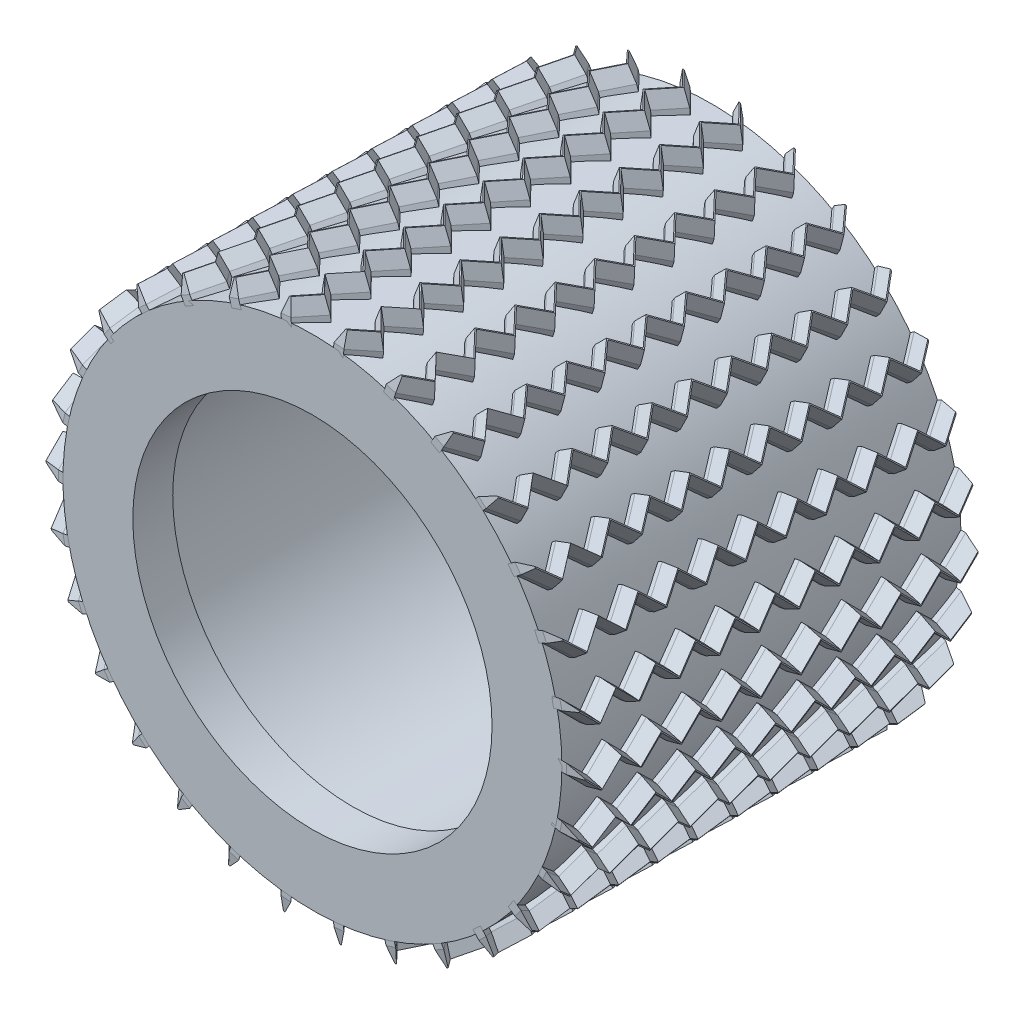
from build123d import *

# Parameters (mm, degrees)
CROQUIS1_R              = 125
CROQUIS1_R_2            = 100
SALIENTE_EXTRUIR1_DEPTH = 80
SALIENTE_EXTRUIR2_START = 20
CROQUIS5_R              = 125
CROQUIS5_R_2            = 90
SALIENTE_EXTRUIR2_DEPTH = 20
SALIENTE_EXTRUIR3_START = -2
SALIENTE_EXTRUIR3_DEPTH = 12
CHAFL_N1_SIZE           = 7.716831024
CHAFL_N1_SIZE_2         = 1.5
MATRIZC7_COUNT          = 30


with BuildPart() as part:
    # Croquis1 → Saliente-Extruir1 (new, symmetric)
    with BuildSketch(Plane.XY):
        Circle(CROQUIS1_R)
        Circle(CROQUIS1_R_2, mode=Mode.SUBTRACT)
    extrude(amount=SALIENTE_EXTRUIR1_DEPTH, both=True)

    # Croquis5 → Saliente-Extruir2 (add)
    with BuildSketch(Plane.XY.offset(80).offset(SALIENTE_EXTRUIR2_START)):
        Circle(CROQUIS5_R)
        Circle(CROQUIS5_R_2, mode=Mode.SUBTRACT)
    saliente_extruir2 = extrude(amount=-SALIENTE_EXTRUIR2_DEPTH)

    # Simetría1: Saliente-Extruir2 across plane
    add(saliente_extruir2.mirror(Plane.XY))


with BuildPart() as body_2:
    # Croquis6 → Saliente-Extruir3 (new body)
    with BuildSketch(Plane(origin=(125, 0, 0), x_dir=(0, 0, -1), z_dir=(1, 0, 0)).offset(SALIENTE_EXTRUIR3_START)):
        Polygon((-100, -2.5), (-100, 2.5), (-89.720842416, -7.866937135), (-80.013744405, 1.758658456), (-70.426515577, -7.90974793), (-60.013744405, 2.415595872), (-50.05585798, -7.626606565), (-40.013744405, 2.331191744), (-30.05585798, -7.711010694), (-20.013744405, 2.246787615), (-10.217845976, -7.632055231), (0, 2.5), (9.915327401, -7.5), (20, 2.5), (29.957886425, -7.542202437), (40, 2.415595872), (49.957886425, -7.626606565), (60, 2.331191744), (69.957886425, -7.711010694), (80, 2.246787615), (89.789084168, -7.625183273), (100, 2.5), (100, -2.5), (89.789084168, -12.625183273), (80, -2.753212385), (69.957886425, -12.711010694), (60, -2.668808256), (49.957886425, -12.626606565), (40, -2.584404128), (29.957886425, -12.542202437), (20, -2.5), (9.915327401, -12.5), (0, -2.5), (-10.217845976, -12.632055231), (-20.013744405, -2.753212385), (-30.05585798, -12.711010694), (-40.013744405, -2.668808256), (-50.05585798, -12.626606565), (-60.013744405, -2.584404128), (-70.05585798, -12.542202437), (-80.013744405, -2.5), (-90.091486613, -12.493127798), align=None)
    extrude(amount=SALIENTE_EXTRUIR3_DEPTH)

    # Chaflán1
    # the kernel refuses this chamfer: 7.716831024, 1.5 mm, written as the material it takes off along each edge
    with BuildSketch(Plane(origin=(135, 16.568412983, -45.882316853), x_dir=(-1, 0, 0), z_dir=(0, -0.7100814791090776, -0.7041195161520982)), Plane(origin=(135, 16.652817111, -25.882316853), x_dir=(-1, 0, 0), z_dir=(0, -0.7100814791090777, -0.704119516152098)), Plane(origin=(135, 16.73722124, -5.882316853), x_dir=(-1, 0, 0), z_dir=(0, -0.7100814791090777, -0.7041195161520979)), Plane(origin=(135, -26.779423677, 55.938174833), x_dir=(-1, 0, 0), z_dir=(0, 0.7100814791090772, 0.7041195161520984)), Plane(origin=(135, 16.568412983, 54.131427552), x_dir=(-1, 0, 0), z_dir=(0, -0.7100814791090766, -0.704119516152099)), Plane(origin=(135, 16.652817111, 74.131427552), x_dir=(-1, 0, 0), z_dir=(0, -0.7100814791090765, -0.7041195161520992)), Plane(origin=(135, -26.863827805, 35.938174833), x_dir=(-1, 0, 0), z_dir=(0, 0.7100814791090778, 0.7041195161520979)), Plane(origin=(135, -26.948231933, 15.938174833), x_dir=(-1, 0, 0), z_dir=(0, 0.7100814791090774, 0.7041195161520982)), Plane(origin=(135, -26.779423677, -44.075569572), x_dir=(-1, 0, 0), z_dir=(0, 0.7100814791090766, 0.704119516152099)), Plane(origin=(135, -26.863827805, -64.075569572), x_dir=(-1, 0, 0), z_dir=(0, 0.7100814791090769, 0.7041195161520987)), Plane(origin=(135, -26.948231933, -84.075569572), x_dir=(-1, 0, 0), z_dir=(0, 0.7100814791090765, 0.7041195161520991))) as chafl_n1_piece_1:
        Polygon((CHAFL_N1_SIZE, 0), (0, -CHAFL_N1_SIZE_2), (0, 0), align=None)
    extrude(amount=34.192447474, mode=Mode.SUBTRACT)
    with BuildSketch(Plane(origin=(135, -7.626606565, -49.957886425), x_dir=(-1, 0, 0), z_dir=(0, 0.7041195161520981, -0.7100814791090776)), Plane(origin=(135, -7.542202437, -29.957886425), x_dir=(-1, 0, 0), z_dir=(0, 0.7041195161520979, -0.7100814791090777)), Plane(origin=(135, -7.711010694, 30.05585798), x_dir=(-1, 0, 0), z_dir=(0, 0.7041195161520991, -0.7100814791090765)), Plane(origin=(135, -7.626606565, 50.05585798), x_dir=(-1, 0, 0), z_dir=(0, 0.7041195161520992, -0.7100814791090764)), Plane(origin=(135, -2.584404128, 60.013744405), x_dir=(-1, 0, 0), z_dir=(0, -0.7041195161520983, 0.7100814791090773)), Plane(origin=(135, -2.668808256, 40.013744405), x_dir=(-1, 0, 0), z_dir=(0, -0.704119516152098, 0.7100814791090777)), Plane(origin=(135, -2.753212385, 20.013744405), x_dir=(-1, 0, 0), z_dir=(0, -0.7041195161520983, 0.7100814791090773)), Plane(origin=(135, -2.584404128, -40), x_dir=(-1, 0, 0), z_dir=(0, -0.7041195161520991, 0.7100814791090765)), Plane(origin=(135, -2.668808256, -60), x_dir=(-1, 0, 0), z_dir=(0, -0.7041195161520988, 0.7100814791090768)), Plane(origin=(135, -2.753212385, -80), x_dir=(-1, 0, 0), z_dir=(0, -0.7041195161520991, 0.7100814791090766)), Plane(origin=(135, -7.711010694, -69.957886425), x_dir=(-1, 0, 0), z_dir=(0, 0.7041195161520983, -0.7100814791090773))) as chafl_n1_piece_2:
        Polygon((CHAFL_N1_SIZE, 0), (0, -CHAFL_N1_SIZE_2), (0, 0), align=None)
    extrude(amount=34.192322331, mode=Mode.SUBTRACT)
    with BuildSketch(Plane(origin=(135, -21.617683147, 4.321893839), x_dir=(-1, 0, 0), z_dir=(0, 0.704119516152098, -0.7100814791090777))) as chafl_n1_piece_3_section:
        Polygon((CHAFL_N1_SIZE, 0), (0, -CHAFL_N1_SIZE_2), (0, 0), align=None)
    chafl_n1_piece_3 = extrude(amount=54.302381083, mode=Mode.PRIVATE)
    chafl_n1_piece_3 = split(chafl_n1_piece_3, bisect_by=Plane(origin=(135, -7.500510383, -9.915833463), z_dir=(0, 0.7040940612347721, -0.7101067193978136)), keep=Keep.TOP, mode=Mode.PRIVATE)
    add(chafl_n1_piece_3, mode=Mode.SUBTRACT)
    with BuildSketch(Plane(origin=(135, 16.737727311, 14.117172773), x_dir=(-1, 0, 0), z_dir=(0, -0.7101067193978136, -0.7040940612347721))) as chafl_n1_piece_4_section:
        Polygon((CHAFL_N1_SIZE, 0), (0, -CHAFL_N1_SIZE_2), (0, 0), align=None)
    chafl_n1_piece_4 = extrude(amount=54.182637018, mode=Mode.PRIVATE)
    chafl_n1_piece_4 = split(chafl_n1_piece_4, bisect_by=Plane(origin=(135, -7.49913847, -9.916196226), z_dir=(0, 0.7100814791090777, 0.704119516152098)), keep=Keep.TOP, mode=Mode.PRIVATE)
    add(chafl_n1_piece_4, mode=Mode.SUBTRACT)
    with BuildSketch(Plane(origin=(135, -7.632055231, 10.217845976), x_dir=(-1, 0, 0), z_dir=(0, 0.7041195161520996, -0.710081479109076))) as chafl_n1_piece_5:
        Polygon((CHAFL_N1_SIZE, 0), (0, -CHAFL_N1_SIZE_2), (0, 0), align=None)
    extrude(amount=34.439804354, mode=Mode.SUBTRACT)
    with BuildSketch(Plane(origin=(135, 16.484008855, 34.131427552), x_dir=(-1, 0, 0), z_dir=(0, -0.7100814791090765, -0.7041195161520992)), Plane(origin=(135, -26.869276471, -3.899837171), x_dir=(-1, 0, 0), z_dir=(0, 0.7100814791090776, 0.7041195161520982))) as chafl_n1_piece_6:
        Polygon((CHAFL_N1_SIZE, 0), (0, -CHAFL_N1_SIZE_2), (0, 0), align=None)
    extrude(amount=33.962389945, mode=Mode.SUBTRACT)
    with BuildSketch(Plane(origin=(135, -7.90974793, 70.426515577), x_dir=(-1, 0, 0), z_dir=(0, 0.704119516152099, -0.7100814791090767))) as chafl_n1_piece_7:
        Polygon((CHAFL_N1_SIZE, 0), (0, -CHAFL_N1_SIZE_2), (0, 0), align=None)
    extrude(amount=34.71431538, mode=Mode.SUBTRACT)
    with BuildSketch(Plane(origin=(135, 15.995879696, 94.131427552), x_dir=(-1, 0, 0), z_dir=(0, -0.7100814791090776, -0.704119516152098))) as chafl_n1_piece_8:
        Polygon((CHAFL_N1_SIZE, 0), (0, -CHAFL_N1_SIZE_2), (0, 0), align=None)
    extrude(amount=33.666034574, mode=Mode.SUBTRACT)
    with BuildSketch(Plane(origin=(135, -21.984620282, 103.958063656), x_dir=(-1, 0, 0), z_dir=(0, 0.7041195161520977, -0.710081479109078))) as chafl_n1_piece_9_section:
        Polygon((CHAFL_N1_SIZE, 0), (0, -CHAFL_N1_SIZE_2), (0, 0), align=None)
    chafl_n1_piece_9 = extrude(amount=53.77064691, mode=Mode.PRIVATE)
    chafl_n1_piece_9 = split(chafl_n1_piece_9, bisect_by=Plane(origin=(135, -7.867447519, 89.720336354), z_dir=(0, 0.7040940612347715, -0.7101067193978142)), keep=Keep.TOP, mode=Mode.PRIVATE)
    add(chafl_n1_piece_9, mode=Mode.SUBTRACT)
    with BuildSketch(Plane(origin=(135, 16.737727311, 114.117172773), x_dir=(-1, 0, 0), z_dir=(0, -0.7101067193978142, -0.7040940612347715))) as chafl_n1_piece_10_section:
        Polygon((CHAFL_N1_SIZE, 0), (0, -CHAFL_N1_SIZE_2), (0, 0), align=None)
    chafl_n1_piece_10 = extrude(amount=54.699372215, mode=Mode.PRIVATE)
    chafl_n1_piece_10 = split(chafl_n1_piece_10, bisect_by=Plane(origin=(135, -7.866062562, 89.719960438), z_dir=(0, 0.710081479109078, 0.7041195161520977)), keep=Keep.TOP, mode=Mode.PRIVATE)
    add(chafl_n1_piece_10, mode=Mode.SUBTRACT)
    with BuildSketch(Plane(origin=(135, -22.550123343, 100), x_dir=(-1, 0, 0), z_dir=(0, 1, 0)), Plane(origin=(135, 22.550123343, -100), x_dir=(-1, 0, 0), z_dir=(0, -1, 0))) as chafl_n1_piece_11:
        Polygon((CHAFL_N1_SIZE, 0), (0, -CHAFL_N1_SIZE_2), (0, 0), align=None)
    extrude(amount=45.100246686, mode=Mode.SUBTRACT)
    with BuildSketch(Plane(origin=(135, 11.617683147, -14.23722124), x_dir=(-1, 0, 0), z_dir=(0, -0.7041195161520982, 0.7100814791090774))) as chafl_n1_piece_12_section:
        Polygon((CHAFL_N1_SIZE, 0), (0, -CHAFL_N1_SIZE_2), (0, 0), align=None)
    chafl_n1_piece_12 = extrude(amount=54.489927697, mode=Mode.PRIVATE)
    chafl_n1_piece_12 = split(chafl_n1_piece_12, bisect_by=Plane(origin=(135, -2.499489617, 0.000506062), z_dir=(0, -0.7040940612347731, 0.7101067193978126)), keep=Keep.TOP, mode=Mode.PRIVATE)
    add(chafl_n1_piece_12, mode=Mode.SUBTRACT)
    with BuildSketch(Plane(origin=(135, -26.737727311, -24.032500174), x_dir=(-1, 0, 0), z_dir=(0, 0.7101067193978126, 0.7040940612347731))) as chafl_n1_piece_13_section:
        Polygon((CHAFL_N1_SIZE, 0), (0, -CHAFL_N1_SIZE_2), (0, 0), align=None)
    chafl_n1_piece_13 = extrude(amount=54.182637018, mode=Mode.PRIVATE)
    chafl_n1_piece_13 = split(chafl_n1_piece_13, bisect_by=Plane(origin=(135, -2.50086153, 0.000868825), z_dir=(0, -0.7100814791090774, -0.7041195161520982)), keep=Keep.TOP, mode=Mode.PRIVATE)
    add(chafl_n1_piece_13, mode=Mode.SUBTRACT)
    with BuildSketch(Plane(origin=(135, -2.5, -20), x_dir=(-1, 0, 0), z_dir=(0, -0.7041195161520988, 0.7100814791090769))) as chafl_n1_piece_14:
        Polygon((CHAFL_N1_SIZE, 0), (0, -CHAFL_N1_SIZE_2), (0, 0), align=None)
    extrude(amount=34.25225774, mode=Mode.SUBTRACT)
    with BuildSketch(Plane(origin=(135, -26.730855108, 75.97431384), x_dir=(-1, 0, 0), z_dir=(0, 0.7101067193978129, 0.7040940612347727))) as chafl_n1_piece_15:
        Polygon((CHAFL_N1_SIZE, 0), (0, -CHAFL_N1_SIZE_2), (0, 0), align=None)
    extrude(amount=54.172959314, mode=Mode.SUBTRACT)
    with BuildSketch(Plane(origin=(135, -26.862404513, -103.906767315), x_dir=(-1, 0, 0), z_dir=(0, 0.7100814791090764, 0.7041195161520992)), Plane(origin=(135, 16.484008855, -65.882316853), x_dir=(-1, 0, 0), z_dir=(0, -0.710081479109077, -0.7041195161520986))) as chafl_n1_piece_16:
        Polygon((CHAFL_N1_SIZE, 0), (0, -CHAFL_N1_SIZE_2), (0, 0), align=None)
    extrude(amount=33.952712241, mode=Mode.SUBTRACT)
    with BuildSketch(Plane(origin=(135, 11.617683147, -114.23722124), x_dir=(-1, 0, 0), z_dir=(0, -0.7041195161520994, 0.7100814791090763))) as chafl_n1_piece_17:
        Polygon((CHAFL_N1_SIZE, 0), (0, -CHAFL_N1_SIZE_2), (0, 0), align=None)
    extrude(amount=54.48016805, mode=Mode.SUBTRACT)
    with BuildSketch(Plane(origin=(135, -7.625183273, -89.789084168), x_dir=(-1, 0, 0), z_dir=(0, 0.7041195161520982, -0.7100814791090774))) as chafl_n1_piece_18:
        Polygon((CHAFL_N1_SIZE, 0), (0, -CHAFL_N1_SIZE_2), (0, 0), align=None)
    extrude(amount=34.430044707, mode=Mode.SUBTRACT)
    with BuildSketch(Plane(origin=(135, -2.5, 80.013744405), x_dir=(-1, 0, 0), z_dir=(0, -0.7041195161520988, 0.7100814791090768))) as chafl_n1_piece_19:
        Polygon((CHAFL_N1_SIZE, 0), (0, -CHAFL_N1_SIZE_2), (0, 0), align=None)
    extrude(amount=34.242497746, mode=Mode.SUBTRACT)
    with BuildSketch(Plane(origin=(135, 2.331191744, -60), x_dir=(-1, 0, 0), z_dir=(0, -0.7100814791090776, -0.7041195161520982))) as chafl_n1_piece_20a_section:
        Polygon((CHAFL_N1_SIZE, 0), (0, -CHAFL_N1_SIZE_2), (0, 0), align=None)
    chafl_n1_piece_20a = extrude(amount=34.192447474, mode=Mode.PRIVATE)
    chafl_n1_piece_20a = split(chafl_n1_piece_20a, bisect_by=Plane(origin=(135, -7.711010694, -69.957886425), z_dir=(0, -0.7100814791090773, -0.7041195161520983)), keep=Keep.TOP, mode=Mode.PRIVATE)
    chafl_n1_piece_20a = split(chafl_n1_piece_20a, bisect_by=Plane(origin=(135, -10.232089228, -72.457797562), z_dir=(0, 0.7100814791090766, 0.7041195161520991)), keep=Keep.TOP, mode=Mode.PRIVATE)
    with BuildSketch(Plane(origin=(135, -21.828693841, -55.720665185), x_dir=(-1, 0, 0), z_dir=(0, 0.7041195161520983, -0.7100814791090773))) as chafl_n1_piece_20b_section:
        Polygon((CHAFL_N1_SIZE, 0), (0, -CHAFL_N1_SIZE_2), (0, 0), align=None)
    chafl_n1_piece_20b = extrude(amount=34.192322331, mode=Mode.PRIVATE)
    chafl_n1_piece_20b = split(chafl_n1_piece_20b, bisect_by=Plane(origin=(135, -7.711010694, -69.957886425), z_dir=(0, -0.7041195161520981, 0.7100814791090775)), keep=Keep.TOP, mode=Mode.PRIVATE)
    chafl_n1_piece_20b = split(chafl_n1_piece_20b, bisect_by=Plane(origin=(135, -10.189932159, -67.457975287), z_dir=(0, 0.7041195161520991, -0.7100814791090765)), keep=Keep.TOP, mode=Mode.PRIVATE)
    chafl_n1_piece_20 = chafl_n1_piece_20a & chafl_n1_piece_20b
    add(chafl_n1_piece_20, mode=Mode.SUBTRACT)
    with BuildSketch(Plane(origin=(135, 2.415595872, -40), x_dir=(-1, 0, 0), z_dir=(0, -0.7100814791090777, -0.704119516152098))) as chafl_n1_piece_21a_section:
        Polygon((CHAFL_N1_SIZE, 0), (0, -CHAFL_N1_SIZE_2), (0, 0), align=None)
    chafl_n1_piece_21a = extrude(amount=34.192447474, mode=Mode.PRIVATE)
    chafl_n1_piece_21a = split(chafl_n1_piece_21a, bisect_by=Plane(origin=(135, -7.626606565, -49.957886425), z_dir=(0, -0.7100814791090776, -0.7041195161520981)), keep=Keep.TOP, mode=Mode.PRIVATE)
    chafl_n1_piece_21a = split(chafl_n1_piece_21a, bisect_by=Plane(origin=(135, -10.1476851, -52.457797562), z_dir=(0, 0.7100814791090768, 0.7041195161520988)), keep=Keep.TOP, mode=Mode.PRIVATE)
    with BuildSketch(Plane(origin=(135, -21.744289712, -35.720665185), x_dir=(-1, 0, 0), z_dir=(0, 0.7041195161520981, -0.7100814791090776))) as chafl_n1_piece_21b_section:
        Polygon((CHAFL_N1_SIZE, 0), (0, -CHAFL_N1_SIZE_2), (0, 0), align=None)
    chafl_n1_piece_21b = extrude(amount=34.192322331, mode=Mode.PRIVATE)
    chafl_n1_piece_21b = split(chafl_n1_piece_21b, bisect_by=Plane(origin=(135, -7.626606565, -49.957886425), z_dir=(0, -0.704119516152098, 0.7100814791090777)), keep=Keep.TOP, mode=Mode.PRIVATE)
    chafl_n1_piece_21b = split(chafl_n1_piece_21b, bisect_by=Plane(origin=(135, -10.105528031, -47.457975287), z_dir=(0, 0.7041195161520987, -0.7100814791090769)), keep=Keep.TOP, mode=Mode.PRIVATE)
    chafl_n1_piece_21 = chafl_n1_piece_21a & chafl_n1_piece_21b
    add(chafl_n1_piece_21, mode=Mode.SUBTRACT)
    with BuildSketch(Plane(origin=(135, 2.5, -20), x_dir=(-1, 0, 0), z_dir=(0, -0.7100814791090777, -0.7041195161520979))) as chafl_n1_piece_22a_section:
        Polygon((CHAFL_N1_SIZE, 0), (0, -CHAFL_N1_SIZE_2), (0, 0), align=None)
    chafl_n1_piece_22a = extrude(amount=34.192447474, mode=Mode.PRIVATE)
    chafl_n1_piece_22a = split(chafl_n1_piece_22a, bisect_by=Plane(origin=(135, -7.542202437, -29.957886425), z_dir=(0, -0.7100814791090777, -0.7041195161520979)), keep=Keep.TOP, mode=Mode.PRIVATE)
    chafl_n1_piece_22a = split(chafl_n1_piece_22a, bisect_by=Plane(origin=(135, -10.063280972, -32.457797562), z_dir=(0, 0.7100814791090765, 0.7041195161520991)), keep=Keep.TOP, mode=Mode.PRIVATE)
    with BuildSketch(Plane(origin=(135, -21.659885584, -15.720665185), x_dir=(-1, 0, 0), z_dir=(0, 0.7041195161520979, -0.7100814791090777))) as chafl_n1_piece_22b_section:
        Polygon((CHAFL_N1_SIZE, 0), (0, -CHAFL_N1_SIZE_2), (0, 0), align=None)
    chafl_n1_piece_22b = extrude(amount=34.192322331, mode=Mode.PRIVATE)
    chafl_n1_piece_22b = split(chafl_n1_piece_22b, bisect_by=Plane(origin=(135, -7.542202437, -29.957886425), z_dir=(0, -0.7041195161520979, 0.7100814791090777)), keep=Keep.TOP, mode=Mode.PRIVATE)
    chafl_n1_piece_22b = split(chafl_n1_piece_22b, bisect_by=Plane(origin=(135, -10.021123902, -27.457975287), z_dir=(0, 0.704119516152099, -0.7100814791090766)), keep=Keep.TOP, mode=Mode.PRIVATE)
    chafl_n1_piece_22 = chafl_n1_piece_22a & chafl_n1_piece_22b
    add(chafl_n1_piece_22, mode=Mode.SUBTRACT)
    with BuildSketch(Plane(origin=(135, 16.737727311, 14.117172773), x_dir=(-1, 0, 0), z_dir=(0, -0.7101067193978136, -0.7040940612347721))) as chafl_n1_piece_23a_section:
        Polygon((CHAFL_N1_SIZE, 0), (0, -CHAFL_N1_SIZE_2), (0, 0), align=None)
    chafl_n1_piece_23a = extrude(amount=54.182637018, mode=Mode.PRIVATE)
    chafl_n1_piece_23a = split(chafl_n1_piece_23a, bisect_by=Plane(origin=(135, -7.49913847, -9.916196226), z_dir=(0, -0.7100814791090777, -0.704119516152098)), keep=Keep.TOP, mode=Mode.PRIVATE)
    chafl_n1_piece_23a = split(chafl_n1_piece_23a, bisect_by=Plane(origin=(135, -10.020217005, -12.416107363), z_dir=(0, 0.7100814791090769, 0.7041195161520988)), keep=Keep.TOP, mode=Mode.PRIVATE)
    with BuildSketch(Plane(origin=(135, -21.617683147, 4.321893839), x_dir=(-1, 0, 0), z_dir=(0, 0.704119516152098, -0.7100814791090777))) as chafl_n1_piece_23b_section:
        Polygon((CHAFL_N1_SIZE, 0), (0, -CHAFL_N1_SIZE_2), (0, 0), align=None)
    chafl_n1_piece_23b = extrude(amount=34.25225774, mode=Mode.PRIVATE)
    chafl_n1_piece_23b = split(chafl_n1_piece_23b, bisect_by=Plane(origin=(135, -7.500510383, -9.915833463), z_dir=(0, -0.7040940612347721, 0.7101067193978136)), keep=Keep.TOP, mode=Mode.PRIVATE)
    chafl_n1_piece_23b = split(chafl_n1_piece_23b, bisect_by=Plane(origin=(135, -9.979252619, -7.415923843), z_dir=(0, 0.7040940612347731, -0.7101067193978126)), keep=Keep.TOP, mode=Mode.PRIVATE)
    chafl_n1_piece_23 = chafl_n1_piece_23a & chafl_n1_piece_23b
    add(chafl_n1_piece_23, mode=Mode.SUBTRACT)
    with BuildSketch(Plane(origin=(135, 2.246787615, 20.013744405), x_dir=(-1, 0, 0), z_dir=(0, -0.7100814791090765, -0.7041195161520992))) as chafl_n1_piece_24a_section:
        Polygon((CHAFL_N1_SIZE, 0), (0, -CHAFL_N1_SIZE_2), (0, 0), align=None)
    chafl_n1_piece_24a = extrude(amount=33.962389945, mode=Mode.PRIVATE)
    chafl_n1_piece_24a = split(chafl_n1_piece_24a, bisect_by=Plane(origin=(135, -7.632055231, 10.217845976), z_dir=(0, -0.710081479109076, -0.7041195161520996)), keep=Keep.TOP, mode=Mode.PRIVATE)
    chafl_n1_piece_24a = split(chafl_n1_piece_24a, bisect_by=Plane(origin=(135, -10.153133766, 7.717934839), z_dir=(0, 0.7100814791090774, 0.7041195161520982)), keep=Keep.TOP, mode=Mode.PRIVATE)
    with BuildSketch(Plane(origin=(135, -21.749738378, 24.455067216), x_dir=(-1, 0, 0), z_dir=(0, 0.7041195161520996, -0.710081479109076))) as chafl_n1_piece_24b_section:
        Polygon((CHAFL_N1_SIZE, 0), (0, -CHAFL_N1_SIZE_2), (0, 0), align=None)
    chafl_n1_piece_24b = extrude(amount=54.489927697, mode=Mode.PRIVATE)
    chafl_n1_piece_24b = split(chafl_n1_piece_24b, bisect_by=Plane(origin=(135, -7.632055231, 10.217845976), z_dir=(0, -0.7041195161520992, 0.7100814791090765)), keep=Keep.TOP, mode=Mode.PRIVATE)
    chafl_n1_piece_24b = split(chafl_n1_piece_24b, bisect_by=Plane(origin=(135, -10.110976696, 12.717757114), z_dir=(0, 0.7041195161520981, -0.7100814791090775)), keep=Keep.TOP, mode=Mode.PRIVATE)
    chafl_n1_piece_24 = chafl_n1_piece_24a & chafl_n1_piece_24b
    add(chafl_n1_piece_24, mode=Mode.SUBTRACT)
    with BuildSketch(Plane(origin=(135, -12.542202437, 70.05585798), x_dir=(-1, 0, 0), z_dir=(0, 0.7100814791090772, 0.7041195161520984))) as chafl_n1_piece_25a_section:
        Polygon((CHAFL_N1_SIZE, 0), (0, -CHAFL_N1_SIZE_2), (0, 0), align=None)
    chafl_n1_piece_25a = extrude(amount=34.192447474, mode=Mode.PRIVATE)
    chafl_n1_piece_25a = split(chafl_n1_piece_25a, bisect_by=Plane(origin=(135, -0.352717516, 82.142997946), z_dir=(0, -0.710081479109078, -0.7041195161520977)), keep=Keep.TOP, mode=Mode.PRIVATE)
    chafl_n1_piece_25a = split(chafl_n1_piece_25a, bisect_by=Plane(origin=(135, -2.5, 80.013744405), z_dir=(0, 0.7100814791090768, 0.7041195161520988)), keep=Keep.TOP, mode=Mode.PRIVATE)
    with BuildSketch(Plane(origin=(135, 11.617683147, 65.776523165), x_dir=(-1, 0, 0), z_dir=(0, -0.7041195161520988, 0.7100814791090768))) as chafl_n1_piece_25b_section:
        Polygon((CHAFL_N1_SIZE, 0), (0, -CHAFL_N1_SIZE_2), (0, 0), align=None)
    chafl_n1_piece_25b = extrude(amount=54.292621089, mode=Mode.PRIVATE)
    chafl_n1_piece_25b = split(chafl_n1_piece_25b, bisect_by=Plane(origin=(135, -0.388624028, 77.884490864), z_dir=(0, -0.704119516152098, 0.7100814791090776)), keep=Keep.TOP, mode=Mode.PRIVATE)
    chafl_n1_piece_25b = split(chafl_n1_piece_25b, bisect_by=Plane(origin=(135, -2.5, 80.013744405), z_dir=(0, 0.7041195161520984, -0.7100814791090772)), keep=Keep.TOP, mode=Mode.PRIVATE)
    chafl_n1_piece_25 = chafl_n1_piece_25a & chafl_n1_piece_25b
    add(chafl_n1_piece_25, mode=Mode.SUBTRACT)
    with BuildSketch(Plane(origin=(135, 2.331191744, 40.013744405), x_dir=(-1, 0, 0), z_dir=(0, -0.7100814791090766, -0.704119516152099))) as chafl_n1_piece_26a_section:
        Polygon((CHAFL_N1_SIZE, 0), (0, -CHAFL_N1_SIZE_2), (0, 0), align=None)
    chafl_n1_piece_26a = extrude(amount=34.192447474, mode=Mode.PRIVATE)
    chafl_n1_piece_26a = split(chafl_n1_piece_26a, bisect_by=Plane(origin=(135, -7.711010694, 30.05585798), z_dir=(0, -0.7100814791090765, -0.7041195161520991)), keep=Keep.TOP, mode=Mode.PRIVATE)
    chafl_n1_piece_26a = split(chafl_n1_piece_26a, bisect_by=Plane(origin=(135, -10.232089228, 27.555946843), z_dir=(0, 0.7100814791090773, 0.7041195161520983)), keep=Keep.TOP, mode=Mode.PRIVATE)
    with BuildSketch(Plane(origin=(135, -21.828693841, 44.29307922), x_dir=(-1, 0, 0), z_dir=(0, 0.7041195161520991, -0.7100814791090765))) as chafl_n1_piece_26b_section:
        Polygon((CHAFL_N1_SIZE, 0), (0, -CHAFL_N1_SIZE_2), (0, 0), align=None)
    chafl_n1_piece_26b = extrude(amount=34.192322331, mode=Mode.PRIVATE)
    chafl_n1_piece_26b = split(chafl_n1_piece_26b, bisect_by=Plane(origin=(135, -7.711010694, 30.05585798), z_dir=(0, -0.704119516152099, 0.7100814791090766)), keep=Keep.TOP, mode=Mode.PRIVATE)
    chafl_n1_piece_26b = split(chafl_n1_piece_26b, bisect_by=Plane(origin=(135, -10.189932159, 32.555769118), z_dir=(0, 0.7041195161520982, -0.7100814791090774)), keep=Keep.TOP, mode=Mode.PRIVATE)
    chafl_n1_piece_26 = chafl_n1_piece_26a & chafl_n1_piece_26b
    add(chafl_n1_piece_26, mode=Mode.SUBTRACT)
    with BuildSketch(Plane(origin=(135, 2.415595872, 60.013744405), x_dir=(-1, 0, 0), z_dir=(0, -0.7100814791090765, -0.7041195161520992))) as chafl_n1_piece_27a_section:
        Polygon((CHAFL_N1_SIZE, 0), (0, -CHAFL_N1_SIZE_2), (0, 0), align=None)
    chafl_n1_piece_27a = extrude(amount=34.192447474, mode=Mode.PRIVATE)
    chafl_n1_piece_27a = split(chafl_n1_piece_27a, bisect_by=Plane(origin=(135, -7.626606565, 50.05585798), z_dir=(0, -0.7100814791090764, -0.7041195161520992)), keep=Keep.TOP, mode=Mode.PRIVATE)
    chafl_n1_piece_27a = split(chafl_n1_piece_27a, bisect_by=Plane(origin=(135, -10.1476851, 47.555946843), z_dir=(0, 0.7100814791090777, 0.704119516152098)), keep=Keep.TOP, mode=Mode.PRIVATE)
    with BuildSketch(Plane(origin=(135, -21.744289712, 64.29307922), x_dir=(-1, 0, 0), z_dir=(0, 0.7041195161520992, -0.7100814791090764))) as chafl_n1_piece_27b_section:
        Polygon((CHAFL_N1_SIZE, 0), (0, -CHAFL_N1_SIZE_2), (0, 0), align=None)
    chafl_n1_piece_27b = extrude(amount=34.192322331, mode=Mode.PRIVATE)
    chafl_n1_piece_27b = split(chafl_n1_piece_27b, bisect_by=Plane(origin=(135, -7.626606565, 50.05585798), z_dir=(0, -0.7041195161520992, 0.7100814791090765)), keep=Keep.TOP, mode=Mode.PRIVATE)
    chafl_n1_piece_27b = split(chafl_n1_piece_27b, bisect_by=Plane(origin=(135, -10.105528031, 52.555769118), z_dir=(0, 0.7041195161520979, -0.7100814791090778)), keep=Keep.TOP, mode=Mode.PRIVATE)
    chafl_n1_piece_27 = chafl_n1_piece_27a & chafl_n1_piece_27b
    add(chafl_n1_piece_27, mode=Mode.SUBTRACT)
    with BuildSketch(Plane(origin=(135, 1.758658456, 80.013744405), x_dir=(-1, 0, 0), z_dir=(0, -0.7100814791090776, -0.704119516152098))) as chafl_n1_piece_28a_section:
        Polygon((CHAFL_N1_SIZE, 0), (0, -CHAFL_N1_SIZE_2), (0, 0), align=None)
    chafl_n1_piece_28a = extrude(amount=33.666034574, mode=Mode.PRIVATE)
    chafl_n1_piece_28a = split(chafl_n1_piece_28a, bisect_by=Plane(origin=(135, -7.90974793, 70.426515577), z_dir=(0, -0.7100814791090767, -0.704119516152099)), keep=Keep.TOP, mode=Mode.PRIVATE)
    chafl_n1_piece_28a = split(chafl_n1_piece_28a, bisect_by=Plane(origin=(135, -10.430826465, 67.926604439), z_dir=(0, 0.7100814791090773, 0.7041195161520983)), keep=Keep.TOP, mode=Mode.PRIVATE)
    with BuildSketch(Plane(origin=(135, -22.027431077, 84.663736816), x_dir=(-1, 0, 0), z_dir=(0, 0.704119516152099, -0.7100814791090767))) as chafl_n1_piece_28b_section:
        Polygon((CHAFL_N1_SIZE, 0), (0, -CHAFL_N1_SIZE_2), (0, 0), align=None)
    chafl_n1_piece_28b = extrude(amount=34.71431538, mode=Mode.PRIVATE)
    chafl_n1_piece_28b = split(chafl_n1_piece_28b, bisect_by=Plane(origin=(135, -7.90974793, 70.426515577), z_dir=(0, -0.704119516152098, 0.7100814791090776)), keep=Keep.TOP, mode=Mode.PRIVATE)
    chafl_n1_piece_28b = split(chafl_n1_piece_28b, bisect_by=Plane(origin=(135, -10.021123902, 72.555769118), z_dir=(0, 0.7041195161520984, -0.7100814791090772)), keep=Keep.TOP, mode=Mode.PRIVATE)
    chafl_n1_piece_28 = chafl_n1_piece_28a & chafl_n1_piece_28b
    add(chafl_n1_piece_28, mode=Mode.SUBTRACT)
    with BuildSketch(Plane(origin=(135, 16.737727311, 114.117172773), x_dir=(-1, 0, 0), z_dir=(0, -0.7101067193978142, -0.7040940612347715))) as chafl_n1_piece_29a_section:
        Polygon((CHAFL_N1_SIZE, 0), (0, -CHAFL_N1_SIZE_2), (0, 0), align=None)
    chafl_n1_piece_29a = extrude(amount=54.699372215, mode=Mode.PRIVATE)
    chafl_n1_piece_29a = split(chafl_n1_piece_29a, bisect_by=Plane(origin=(135, -7.866062562, 89.719960438), z_dir=(0, -0.710081479109078, -0.7041195161520977)), keep=Keep.TOP, mode=Mode.PRIVATE)
    chafl_n1_piece_29a = split(chafl_n1_piece_29a, bisect_by=Plane(origin=(135, -10.013345047, 87.590706897), z_dir=(0, 0.7100814791090768, 0.7041195161520988)), keep=Keep.TOP, mode=Mode.PRIVATE)
    with BuildSketch(Plane(origin=(135, -21.984620282, 103.958063656), x_dir=(-1, 0, 0), z_dir=(0, 0.7041195161520977, -0.710081479109078))) as chafl_n1_piece_29b_section:
        Polygon((CHAFL_N1_SIZE, 0), (0, -CHAFL_N1_SIZE_2), (0, 0), align=None)
    chafl_n1_piece_29b = extrude(amount=33.720523567, mode=Mode.PRIVATE)
    chafl_n1_piece_29b = split(chafl_n1_piece_29b, bisect_by=Plane(origin=(135, -7.867447519, 89.720336354), z_dir=(0, -0.7040940612347715, 0.7101067193978142)), keep=Keep.TOP, mode=Mode.PRIVATE)
    chafl_n1_piece_29b = split(chafl_n1_piece_29b, bisect_by=Plane(origin=(135, -10.346189754, 92.220245974), z_dir=(0, 0.7040940612347727, -0.7101067193978129)), keep=Keep.TOP, mode=Mode.PRIVATE)
    chafl_n1_piece_29 = chafl_n1_piece_29a & chafl_n1_piece_29b
    add(chafl_n1_piece_29, mode=Mode.SUBTRACT)
    with BuildSketch(Plane(origin=(135, -12.626606565, 50.05585798), x_dir=(-1, 0, 0), z_dir=(0, 0.7100814791090778, 0.7041195161520979))) as chafl_n1_piece_30a_section:
        Polygon((CHAFL_N1_SIZE, 0), (0, -CHAFL_N1_SIZE_2), (0, 0), align=None)
    chafl_n1_piece_30a = extrude(amount=34.192447474, mode=Mode.PRIVATE)
    chafl_n1_piece_30a = split(chafl_n1_piece_30a, bisect_by=Plane(origin=(135, -0.063325593, 62.513655542), z_dir=(0, -0.7100814791090767, -0.704119516152099)), keep=Keep.TOP, mode=Mode.PRIVATE)
    chafl_n1_piece_30a = split(chafl_n1_piece_30a, bisect_by=Plane(origin=(135, -2.584404128, 60.013744405), z_dir=(0, 0.7100814791090773, 0.7041195161520983)), keep=Keep.TOP, mode=Mode.PRIVATE)
    with BuildSketch(Plane(origin=(135, 11.533279019, 45.776523165), x_dir=(-1, 0, 0), z_dir=(0, -0.7041195161520983, 0.7100814791090773))) as chafl_n1_piece_30b_section:
        Polygon((CHAFL_N1_SIZE, 0), (0, -CHAFL_N1_SIZE_2), (0, 0), align=None)
    chafl_n1_piece_30b = extrude(amount=34.192322331, mode=Mode.PRIVATE)
    chafl_n1_piece_30b = split(chafl_n1_piece_30b, bisect_by=Plane(origin=(135, -0.105482663, 57.513833267), z_dir=(0, -0.7041195161520992, 0.7100814791090765)), keep=Keep.TOP, mode=Mode.PRIVATE)
    chafl_n1_piece_30b = split(chafl_n1_piece_30b, bisect_by=Plane(origin=(135, -2.584404128, 60.013744405), z_dir=(0, 0.7041195161520979, -0.7100814791090778)), keep=Keep.TOP, mode=Mode.PRIVATE)
    chafl_n1_piece_30 = chafl_n1_piece_30a & chafl_n1_piece_30b
    add(chafl_n1_piece_30, mode=Mode.SUBTRACT)
    with BuildSketch(Plane(origin=(135, -12.711010694, 30.05585798), x_dir=(-1, 0, 0), z_dir=(0, 0.7100814791090774, 0.7041195161520982))) as chafl_n1_piece_31a_section:
        Polygon((CHAFL_N1_SIZE, 0), (0, -CHAFL_N1_SIZE_2), (0, 0), align=None)
    chafl_n1_piece_31a = extrude(amount=34.192447474, mode=Mode.PRIVATE)
    chafl_n1_piece_31a = split(chafl_n1_piece_31a, bisect_by=Plane(origin=(135, -0.147729722, 42.513655542), z_dir=(0, -0.7100814791090764, -0.7041195161520992)), keep=Keep.TOP, mode=Mode.PRIVATE)
    chafl_n1_piece_31a = split(chafl_n1_piece_31a, bisect_by=Plane(origin=(135, -2.668808256, 40.013744405), z_dir=(0, 0.7100814791090777, 0.704119516152098)), keep=Keep.TOP, mode=Mode.PRIVATE)
    with BuildSketch(Plane(origin=(135, 11.448874891, 25.776523165), x_dir=(-1, 0, 0), z_dir=(0, -0.704119516152098, 0.7100814791090777))) as chafl_n1_piece_31b_section:
        Polygon((CHAFL_N1_SIZE, 0), (0, -CHAFL_N1_SIZE_2), (0, 0), align=None)
    chafl_n1_piece_31b = extrude(amount=34.192322331, mode=Mode.PRIVATE)
    chafl_n1_piece_31b = split(chafl_n1_piece_31b, bisect_by=Plane(origin=(135, -0.189886791, 37.513833267), z_dir=(0, -0.704119516152099, 0.7100814791090766)), keep=Keep.TOP, mode=Mode.PRIVATE)
    chafl_n1_piece_31b = split(chafl_n1_piece_31b, bisect_by=Plane(origin=(135, -2.668808256, 40.013744405), z_dir=(0, 0.7041195161520982, -0.7100814791090774)), keep=Keep.TOP, mode=Mode.PRIVATE)
    chafl_n1_piece_31 = chafl_n1_piece_31a & chafl_n1_piece_31b
    add(chafl_n1_piece_31, mode=Mode.SUBTRACT)
    with BuildSketch(Plane(origin=(135, -12.632055231, 10.217845976), x_dir=(-1, 0, 0), z_dir=(0, 0.7100814791090776, 0.7041195161520982))) as chafl_n1_piece_32a_section:
        Polygon((CHAFL_N1_SIZE, 0), (0, -CHAFL_N1_SIZE_2), (0, 0), align=None)
    chafl_n1_piece_32a = extrude(amount=33.962389945, mode=Mode.PRIVATE)
    chafl_n1_piece_32a = split(chafl_n1_piece_32a, bisect_by=Plane(origin=(135, -0.23213385, 22.513655542), z_dir=(0, -0.7100814791090765, -0.7041195161520991)), keep=Keep.TOP, mode=Mode.PRIVATE)
    chafl_n1_piece_32a = split(chafl_n1_piece_32a, bisect_by=Plane(origin=(135, -2.753212385, 20.013744405), z_dir=(0, 0.7100814791090773, 0.7041195161520983)), keep=Keep.TOP, mode=Mode.PRIVATE)
    with BuildSketch(Plane(origin=(135, 11.364470762, 5.776523165), x_dir=(-1, 0, 0), z_dir=(0, -0.7041195161520983, 0.7100814791090773))) as chafl_n1_piece_32b_section:
        Polygon((CHAFL_N1_SIZE, 0), (0, -CHAFL_N1_SIZE_2), (0, 0), align=None)
    chafl_n1_piece_32b = extrude(amount=34.192322331, mode=Mode.PRIVATE)
    chafl_n1_piece_32b = split(chafl_n1_piece_32b, bisect_by=Plane(origin=(135, -0.27429092, 17.513833267), z_dir=(0, -0.7041195161520992, 0.7100814791090765)), keep=Keep.TOP, mode=Mode.PRIVATE)
    chafl_n1_piece_32b = split(chafl_n1_piece_32b, bisect_by=Plane(origin=(135, -2.753212385, 20.013744405), z_dir=(0, 0.7041195161520981, -0.7100814791090775)), keep=Keep.TOP, mode=Mode.PRIVATE)
    chafl_n1_piece_32 = chafl_n1_piece_32a & chafl_n1_piece_32b
    add(chafl_n1_piece_32, mode=Mode.SUBTRACT)
    with BuildSketch(Plane(origin=(135, -26.737727311, -24.032500174), x_dir=(-1, 0, 0), z_dir=(0, 0.7101067193978126, 0.7040940612347731))) as chafl_n1_piece_33a_section:
        Polygon((CHAFL_N1_SIZE, 0), (0, -CHAFL_N1_SIZE_2), (0, 0), align=None)
    chafl_n1_piece_33a = extrude(amount=54.182637018, mode=Mode.PRIVATE)
    chafl_n1_piece_33a = split(chafl_n1_piece_33a, bisect_by=Plane(origin=(135, 0.020217005, 2.500779962), z_dir=(0, -0.710081479109076, -0.7041195161520996)), keep=Keep.TOP, mode=Mode.PRIVATE)
    chafl_n1_piece_33a = split(chafl_n1_piece_33a, bisect_by=Plane(origin=(135, -2.50086153, 0.000868825), z_dir=(0, 0.7100814791090774, 0.7041195161520982)), keep=Keep.TOP, mode=Mode.PRIVATE)
    with BuildSketch(Plane(origin=(135, 11.617683147, -14.23722124), x_dir=(-1, 0, 0), z_dir=(0, -0.7041195161520982, 0.7100814791090774))) as chafl_n1_piece_33b_section:
        Polygon((CHAFL_N1_SIZE, 0), (0, -CHAFL_N1_SIZE_2), (0, 0), align=None)
    chafl_n1_piece_33b = extrude(amount=34.439804354, mode=Mode.PRIVATE)
    chafl_n1_piece_33b = split(chafl_n1_piece_33b, bisect_by=Plane(origin=(135, -0.020747381, -2.499403558), z_dir=(0, -0.7040940612347721, 0.7101067193978136)), keep=Keep.TOP, mode=Mode.PRIVATE)
    chafl_n1_piece_33b = split(chafl_n1_piece_33b, bisect_by=Plane(origin=(135, -2.499489617, 0.000506062), z_dir=(0, 0.7040940612347731, -0.7101067193978126)), keep=Keep.TOP, mode=Mode.PRIVATE)
    chafl_n1_piece_33 = chafl_n1_piece_33a & chafl_n1_piece_33b
    add(chafl_n1_piece_33, mode=Mode.SUBTRACT)
    with BuildSketch(Plane(origin=(135, -12.542202437, -29.957886425), x_dir=(-1, 0, 0), z_dir=(0, 0.7100814791090766, 0.704119516152099))) as chafl_n1_piece_34a_section:
        Polygon((CHAFL_N1_SIZE, 0), (0, -CHAFL_N1_SIZE_2), (0, 0), align=None)
    chafl_n1_piece_34a = extrude(amount=34.192447474, mode=Mode.PRIVATE)
    chafl_n1_piece_34a = split(chafl_n1_piece_34a, bisect_by=Plane(origin=(135, 0.021078535, -17.500088863), z_dir=(0, -0.7100814791090777, -0.704119516152098)), keep=Keep.TOP, mode=Mode.PRIVATE)
    chafl_n1_piece_34a = split(chafl_n1_piece_34a, bisect_by=Plane(origin=(135, -2.5, -20), z_dir=(0, 0.7100814791090769, 0.7041195161520988)), keep=Keep.TOP, mode=Mode.PRIVATE)
    with BuildSketch(Plane(origin=(135, 11.617683147, -34.23722124), x_dir=(-1, 0, 0), z_dir=(0, -0.7041195161520988, 0.7100814791090769))) as chafl_n1_piece_34b_section:
        Polygon((CHAFL_N1_SIZE, 0), (0, -CHAFL_N1_SIZE_2), (0, 0), align=None)
    chafl_n1_piece_34b = extrude(amount=54.302381083, mode=Mode.PRIVATE)
    chafl_n1_piece_34b = split(chafl_n1_piece_34b, bisect_by=Plane(origin=(135, -0.021078535, -22.499911137), z_dir=(0, -0.7041195161520979, 0.7100814791090777)), keep=Keep.TOP, mode=Mode.PRIVATE)
    chafl_n1_piece_34b = split(chafl_n1_piece_34b, bisect_by=Plane(origin=(135, -2.5, -20), z_dir=(0, 0.704119516152099, -0.7100814791090766)), keep=Keep.TOP, mode=Mode.PRIVATE)
    chafl_n1_piece_34 = chafl_n1_piece_34a & chafl_n1_piece_34b
    add(chafl_n1_piece_34, mode=Mode.SUBTRACT)
    with BuildSketch(Plane(origin=(135, -12.626606565, -49.957886425), x_dir=(-1, 0, 0), z_dir=(0, 0.7100814791090769, 0.7041195161520987))) as chafl_n1_piece_35a_section:
        Polygon((CHAFL_N1_SIZE, 0), (0, -CHAFL_N1_SIZE_2), (0, 0), align=None)
    chafl_n1_piece_35a = extrude(amount=34.192447474, mode=Mode.PRIVATE)
    chafl_n1_piece_35a = split(chafl_n1_piece_35a, bisect_by=Plane(origin=(135, -0.063325593, -37.500088863), z_dir=(0, -0.7100814791090777, -0.7041195161520979)), keep=Keep.TOP, mode=Mode.PRIVATE)
    chafl_n1_piece_35a = split(chafl_n1_piece_35a, bisect_by=Plane(origin=(135, -2.584404128, -40), z_dir=(0, 0.7100814791090765, 0.7041195161520991)), keep=Keep.TOP, mode=Mode.PRIVATE)
    with BuildSketch(Plane(origin=(135, 11.533279019, -54.23722124), x_dir=(-1, 0, 0), z_dir=(0, -0.7041195161520991, 0.7100814791090765))) as chafl_n1_piece_35b_section:
        Polygon((CHAFL_N1_SIZE, 0), (0, -CHAFL_N1_SIZE_2), (0, 0), align=None)
    chafl_n1_piece_35b = extrude(amount=34.192322331, mode=Mode.PRIVATE)
    chafl_n1_piece_35b = split(chafl_n1_piece_35b, bisect_by=Plane(origin=(135, -0.105482663, -42.499911137), z_dir=(0, -0.704119516152098, 0.7100814791090777)), keep=Keep.TOP, mode=Mode.PRIVATE)
    chafl_n1_piece_35b = split(chafl_n1_piece_35b, bisect_by=Plane(origin=(135, -2.584404128, -40), z_dir=(0, 0.7041195161520987, -0.7100814791090769)), keep=Keep.TOP, mode=Mode.PRIVATE)
    chafl_n1_piece_35 = chafl_n1_piece_35a & chafl_n1_piece_35b
    add(chafl_n1_piece_35, mode=Mode.SUBTRACT)
    with BuildSketch(Plane(origin=(135, -12.711010694, -69.957886425), x_dir=(-1, 0, 0), z_dir=(0, 0.7100814791090765, 0.7041195161520991))) as chafl_n1_piece_36a_section:
        Polygon((CHAFL_N1_SIZE, 0), (0, -CHAFL_N1_SIZE_2), (0, 0), align=None)
    chafl_n1_piece_36a = extrude(amount=34.192447474, mode=Mode.PRIVATE)
    chafl_n1_piece_36a = split(chafl_n1_piece_36a, bisect_by=Plane(origin=(135, -0.147729722, -57.500088863), z_dir=(0, -0.7100814791090776, -0.7041195161520981)), keep=Keep.TOP, mode=Mode.PRIVATE)
    chafl_n1_piece_36a = split(chafl_n1_piece_36a, bisect_by=Plane(origin=(135, -2.668808256, -60), z_dir=(0, 0.7100814791090768, 0.7041195161520988)), keep=Keep.TOP, mode=Mode.PRIVATE)
    with BuildSketch(Plane(origin=(135, 11.448874891, -74.23722124), x_dir=(-1, 0, 0), z_dir=(0, -0.7041195161520988, 0.7100814791090768))) as chafl_n1_piece_36b_section:
        Polygon((CHAFL_N1_SIZE, 0), (0, -CHAFL_N1_SIZE_2), (0, 0), align=None)
    chafl_n1_piece_36b = extrude(amount=34.192322331, mode=Mode.PRIVATE)
    chafl_n1_piece_36b = split(chafl_n1_piece_36b, bisect_by=Plane(origin=(135, -0.189886791, -62.499911137), z_dir=(0, -0.7041195161520981, 0.7100814791090775)), keep=Keep.TOP, mode=Mode.PRIVATE)
    chafl_n1_piece_36b = split(chafl_n1_piece_36b, bisect_by=Plane(origin=(135, -2.668808256, -60), z_dir=(0, 0.7041195161520991, -0.7100814791090765)), keep=Keep.TOP, mode=Mode.PRIVATE)
    chafl_n1_piece_36 = chafl_n1_piece_36a & chafl_n1_piece_36b
    add(chafl_n1_piece_36, mode=Mode.SUBTRACT)
    with BuildSketch(Plane(origin=(135, -12.625183273, -89.789084168), x_dir=(-1, 0, 0), z_dir=(0, 0.7100814791090764, 0.7041195161520992))) as chafl_n1_piece_37a_section:
        Polygon((CHAFL_N1_SIZE, 0), (0, -CHAFL_N1_SIZE_2), (0, 0), align=None)
    chafl_n1_piece_37a = extrude(amount=33.952712241, mode=Mode.PRIVATE)
    chafl_n1_piece_37a = split(chafl_n1_piece_37a, bisect_by=Plane(origin=(135, -0.23213385, -77.500088863), z_dir=(0, -0.7100814791090773, -0.7041195161520983)), keep=Keep.TOP, mode=Mode.PRIVATE)
    chafl_n1_piece_37a = split(chafl_n1_piece_37a, bisect_by=Plane(origin=(135, -2.753212385, -80), z_dir=(0, 0.7100814791090766, 0.7041195161520991)), keep=Keep.TOP, mode=Mode.PRIVATE)
    with BuildSketch(Plane(origin=(135, 11.364470762, -94.23722124), x_dir=(-1, 0, 0), z_dir=(0, -0.7041195161520991, 0.7100814791090766))) as chafl_n1_piece_37b_section:
        Polygon((CHAFL_N1_SIZE, 0), (0, -CHAFL_N1_SIZE_2), (0, 0), align=None)
    chafl_n1_piece_37b = extrude(amount=34.192322331, mode=Mode.PRIVATE)
    chafl_n1_piece_37b = split(chafl_n1_piece_37b, bisect_by=Plane(origin=(135, -0.27429092, -82.499911137), z_dir=(0, -0.7041195161520986, 0.710081479109077)), keep=Keep.TOP, mode=Mode.PRIVATE)
    chafl_n1_piece_37b = split(chafl_n1_piece_37b, bisect_by=Plane(origin=(135, -2.753212385, -80), z_dir=(0, 0.7041195161520992, -0.7100814791090764)), keep=Keep.TOP, mode=Mode.PRIVATE)
    chafl_n1_piece_37 = chafl_n1_piece_37a & chafl_n1_piece_37b
    add(chafl_n1_piece_37, mode=Mode.SUBTRACT)
    with BuildSketch(Plane(origin=(135, 2.246787615, -80), x_dir=(-1, 0, 0), z_dir=(0, -0.710081479109077, -0.7041195161520986))) as chafl_n1_piece_38a_section:
        Polygon((CHAFL_N1_SIZE, 0), (0, -CHAFL_N1_SIZE_2), (0, 0), align=None)
    chafl_n1_piece_38a = extrude(amount=33.952712241, mode=Mode.PRIVATE)
    chafl_n1_piece_38a = split(chafl_n1_piece_38a, bisect_by=Plane(origin=(135, -7.625183273, -89.789084168), z_dir=(0, -0.7100814791090774, -0.7041195161520982)), keep=Keep.TOP, mode=Mode.PRIVATE)
    chafl_n1_piece_38a = split(chafl_n1_piece_38a, bisect_by=Plane(origin=(135, -10.146261808, -92.288995306), z_dir=(0, 0.7100814791090763, 0.7041195161520994)), keep=Keep.TOP, mode=Mode.PRIVATE)
    with BuildSketch(Plane(origin=(135, -21.74286642, -75.551862929), x_dir=(-1, 0, 0), z_dir=(0, 0.7041195161520982, -0.7100814791090774))) as chafl_n1_piece_38b_section:
        Polygon((CHAFL_N1_SIZE, 0), (0, -CHAFL_N1_SIZE_2), (0, 0), align=None)
    chafl_n1_piece_38b = extrude(amount=54.48016805, mode=Mode.PRIVATE)
    chafl_n1_piece_38b = split(chafl_n1_piece_38b, bisect_by=Plane(origin=(135, -7.625183273, -89.789084168), z_dir=(0, -0.7041195161520986, 0.710081479109077)), keep=Keep.TOP, mode=Mode.PRIVATE)
    chafl_n1_piece_38b = split(chafl_n1_piece_38b, bisect_by=Plane(origin=(135, -10.104104738, -87.289173031), z_dir=(0, 0.7041195161520992, -0.7100814791090764)), keep=Keep.TOP, mode=Mode.PRIVATE)
    chafl_n1_piece_38 = chafl_n1_piece_38a & chafl_n1_piece_38b
    add(chafl_n1_piece_38, mode=Mode.SUBTRACT)


with BuildPart() as matrizc7_1:
    # MatrizC7: pattern copy
    add(body_2.part.rotate(Axis((0, 0, 0), (0, 0, 1)), 1 * 360 / MATRIZC7_COUNT))


with BuildPart() as matrizc7_2:
    # MatrizC7: pattern copy
    add(body_2.part.rotate(Axis((0, 0, 0), (0, 0, 1)), 2 * 360 / MATRIZC7_COUNT))


with BuildPart() as matrizc7_3:
    # MatrizC7: pattern copy
    add(body_2.part.rotate(Axis((0, 0, 0), (0, 0, 1)), 3 * 360 / MATRIZC7_COUNT))


with BuildPart() as matrizc7_4:
    # MatrizC7: pattern copy
    add(body_2.part.rotate(Axis((0, 0, 0), (0, 0, 1)), 4 * 360 / MATRIZC7_COUNT))


with BuildPart() as matrizc7_5:
    # MatrizC7: pattern copy
    add(body_2.part.rotate(Axis((0, 0, 0), (0, 0, 1)), 5 * 360 / MATRIZC7_COUNT))


with BuildPart() as matrizc7_6:
    # MatrizC7: pattern copy
    add(body_2.part.rotate(Axis((0, 0, 0), (0, 0, 1)), 6 * 360 / MATRIZC7_COUNT))


with BuildPart() as matrizc7_7:
    # MatrizC7: pattern copy
    add(body_2.part.rotate(Axis((0, 0, 0), (0, 0, 1)), 7 * 360 / MATRIZC7_COUNT))


with BuildPart() as matrizc7_8:
    # MatrizC7: pattern copy
    add(body_2.part.rotate(Axis((0, 0, 0), (0, 0, 1)), 8 * 360 / MATRIZC7_COUNT))


with BuildPart() as matrizc7_9:
    # MatrizC7: pattern copy
    add(body_2.part.rotate(Axis((0, 0, 0), (0, 0, 1)), 9 * 360 / MATRIZC7_COUNT))


with BuildPart() as matrizc7_10:
    # MatrizC7: pattern copy
    add(body_2.part.rotate(Axis((0, 0, 0), (0, 0, 1)), 10 * 360 / MATRIZC7_COUNT))


with BuildPart() as matrizc7_11:
    # MatrizC7: pattern copy
    add(body_2.part.rotate(Axis((0, 0, 0), (0, 0, 1)), 11 * 360 / MATRIZC7_COUNT))


with BuildPart() as matrizc7_12:
    # MatrizC7: pattern copy
    add(body_2.part.rotate(Axis((0, 0, 0), (0, 0, 1)), 12 * 360 / MATRIZC7_COUNT))


with BuildPart() as matrizc7_13:
    # MatrizC7: pattern copy
    add(body_2.part.rotate(Axis((0, 0, 0), (0, 0, 1)), 13 * 360 / MATRIZC7_COUNT))


with BuildPart() as matrizc7_14:
    # MatrizC7: pattern copy
    add(body_2.part.rotate(Axis((0, 0, 0), (0, 0, 1)), 14 * 360 / MATRIZC7_COUNT))


with BuildPart() as matrizc7_15:
    # MatrizC7: pattern copy
    add(body_2.part.rotate(Axis((0, 0, 0), (0, 0, 1)), 15 * 360 / MATRIZC7_COUNT))


with BuildPart() as matrizc7_16:
    # MatrizC7: pattern copy
    add(body_2.part.rotate(Axis((0, 0, 0), (0, 0, 1)), 16 * 360 / MATRIZC7_COUNT))


with BuildPart() as matrizc7_17:
    # MatrizC7: pattern copy
    add(body_2.part.rotate(Axis((0, 0, 0), (0, 0, 1)), 17 * 360 / MATRIZC7_COUNT))


with BuildPart() as matrizc7_18:
    # MatrizC7: pattern copy
    add(body_2.part.rotate(Axis((0, 0, 0), (0, 0, 1)), 18 * 360 / MATRIZC7_COUNT))


with BuildPart() as matrizc7_19:
    # MatrizC7: pattern copy
    add(body_2.part.rotate(Axis((0, 0, 0), (0, 0, 1)), 19 * 360 / MATRIZC7_COUNT))


with BuildPart() as matrizc7_20:
    # MatrizC7: pattern copy
    add(body_2.part.rotate(Axis((0, 0, 0), (0, 0, 1)), 20 * 360 / MATRIZC7_COUNT))


with BuildPart() as matrizc7_21:
    # MatrizC7: pattern copy
    add(body_2.part.rotate(Axis((0, 0, 0), (0, 0, 1)), 21 * 360 / MATRIZC7_COUNT))


with BuildPart() as matrizc7_22:
    # MatrizC7: pattern copy
    add(body_2.part.rotate(Axis((0, 0, 0), (0, 0, 1)), 22 * 360 / MATRIZC7_COUNT))


with BuildPart() as matrizc7_23:
    # MatrizC7: pattern copy
    add(body_2.part.rotate(Axis((0, 0, 0), (0, 0, 1)), 23 * 360 / MATRIZC7_COUNT))


with BuildPart() as matrizc7_24:
    # MatrizC7: pattern copy
    add(body_2.part.rotate(Axis((0, 0, 0), (0, 0, 1)), 24 * 360 / MATRIZC7_COUNT))


with BuildPart() as matrizc7_25:
    # MatrizC7: pattern copy
    add(body_2.part.rotate(Axis((0, 0, 0), (0, 0, 1)), 25 * 360 / MATRIZC7_COUNT))


with BuildPart() as matrizc7_26:
    # MatrizC7: pattern copy
    add(body_2.part.rotate(Axis((0, 0, 0), (0, 0, 1)), 26 * 360 / MATRIZC7_COUNT))


with BuildPart() as matrizc7_27:
    # MatrizC7: pattern copy
    add(body_2.part.rotate(Axis((0, 0, 0), (0, 0, 1)), 27 * 360 / MATRIZC7_COUNT))


with BuildPart() as matrizc7_28:
    # MatrizC7: pattern copy
    add(body_2.part.rotate(Axis((0, 0, 0), (0, 0, 1)), 28 * 360 / MATRIZC7_COUNT))


with BuildPart() as matrizc7_29:
    # MatrizC7: pattern copy
    add(body_2.part.rotate(Axis((0, 0, 0), (0, 0, 1)), 29 * 360 / MATRIZC7_COUNT))


solid = Compound([part.part, body_2.part, matrizc7_1.part, matrizc7_2.part, matrizc7_3.part, matrizc7_4.part, matrizc7_5.part, matrizc7_6.part, matrizc7_7.part, matrizc7_8.part, matrizc7_9.part, matrizc7_10.part, matrizc7_11.part, matrizc7_12.part, matrizc7_13.part, matrizc7_14.part, matrizc7_15.part, matrizc7_16.part, matrizc7_17.part, matrizc7_18.part, matrizc7_19.part, matrizc7_20.part, matrizc7_21.part, matrizc7_22.part, matrizc7_23.part, matrizc7_24.part, matrizc7_25.part, matrizc7_26.part, matrizc7_27.part, matrizc7_28.part, matrizc7_29.part])
